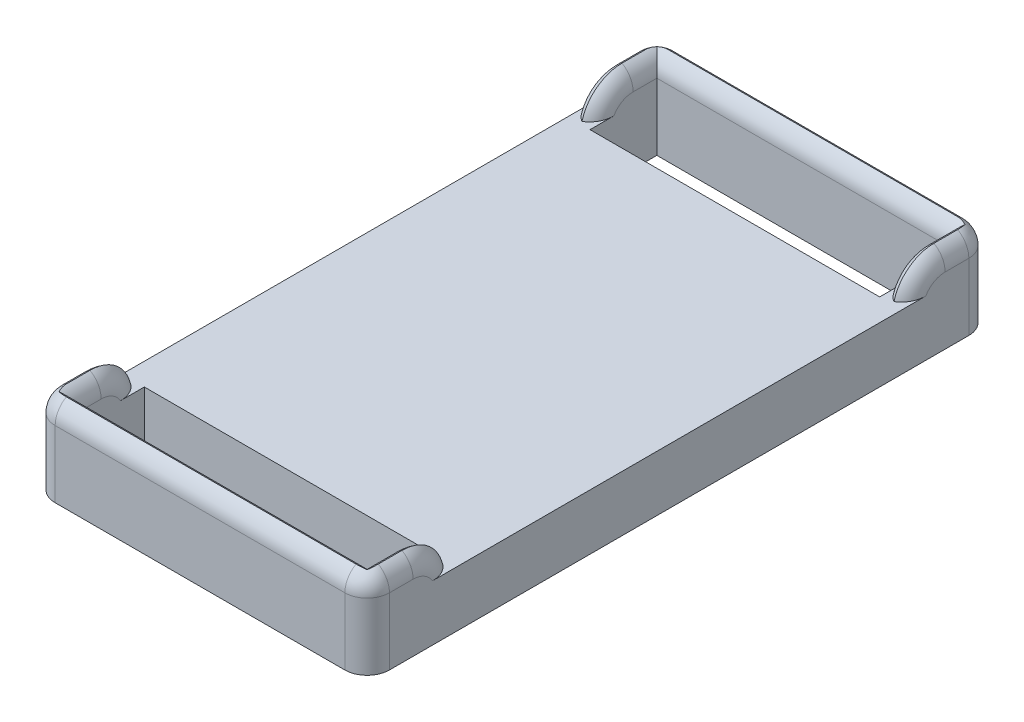
from build123d import *

# Parameters (mm, degrees)
SKETCH1_W           = 13
SKETCH1_H           = 3
BOSS_EXTRUDE1_DEPTH = 4
SKETCH2_W           = 15
SKETCH2_H           = 20
CUT_EXTRUDE1_DEPTH  = 1.5
FILLET1_R           = 2
FILLET2_R           = 1


with BuildPart() as part:
    # Sketch1 → Boss-Extrude1 (new body)
    with BuildSketch(Plane(origin=(0, 0, 0), x_dir=(1, 0, 0), z_dir=(0, 1, 0))):
        Polygon((0, 0), (0, 20), (0, 24), (15, 24), (15, 20), (15, 0), (15, -4), (0, -4), align=None)
        with Locations((7.5, 21.5)):
            Rectangle(SKETCH1_W, SKETCH1_H, mode=Mode.SUBTRACT)
        with Locations((7.5, -1.5)):
            Rectangle(SKETCH1_W, SKETCH1_H, mode=Mode.SUBTRACT)
    extrude(amount=BOSS_EXTRUDE1_DEPTH)

    # Sketch2 → Cut-Extrude1 (cut)
    with BuildSketch(Plane(origin=(0, 4, 0), x_dir=(1, 0, 0), z_dir=(0, 1, 0))):
        with Locations((7.5, 10)):
            Rectangle(SKETCH2_W, SKETCH2_H)
    extrude(amount=-CUT_EXTRUDE1_DEPTH, mode=Mode.SUBTRACT)

    # Fillet1
    # the kernel refuses this fillet: 2 mm, written as the material it takes off along each edge
    with BuildSketch(Plane(origin=(-4.841229183, 4, 0), x_dir=(0, -1, 0), z_dir=(1, 0, 0))) as fillet1_piece_1:
        with BuildLine():
            CenterArc((2, -1.936491673), FILLET1_R, 104.477512186, 75.522487814)
            Line((0, -1.936491673), (-0.04, -1.936491673))
            Line((-0.04, -1.936491673), (-0.04, 0))
            Line((-0.04, 0), (0, 0.04))
            ThreePointArc((0, 0.04), (0.75, 0.04), (1.49, 0.038729833))
            Line((1.49, 0.038729833), (1.5, 0))
        make_face()
    extrude(amount=10.682458366, mode=Mode.SUBTRACT)
    with BuildSketch(Plane(origin=(9.158770817, 4, 0), x_dir=(0, 0, 1), z_dir=(1, 0, 0)), Plane(origin=(19.841229183, 4, -20), x_dir=(0, 0, -1), z_dir=(-1, 0, 0)), Plane(origin=(5.841229183, 4, -20), x_dir=(0, 0, -1), z_dir=(-1, 0, 0))) as fillet1_piece_2:
        with BuildLine():
            CenterArc((1.936491673, 2), FILLET1_R, 194.477512186, 75.522487814)
            Line((0, 1.5), (-0.038729833, 1.49))
            ThreePointArc((-0.038729833, 1.49), (-0.04, 0.75), (-0.04, 0))
            Line((-0.04, 0), (0, -0.04))
            Line((0, -0.04), (1.936491673, -0.04))
            Line((1.936491673, -0.04), (1.936491673, 0))
        make_face()
    extrude(amount=10.682458366, mode=Mode.SUBTRACT)

    # Fillet2
    # the kernel refuses this fillet: 1 mm, written as the material it takes off along each edge
    with BuildSketch(Plane(origin=(14, 3, 3), x_dir=(0, 0, 1), z_dir=(1, 0, 0))) as fillet2_piece_1_section:
        Polygon((0, 0), (FILLET2_R * 1.02, 0), (FILLET2_R * 1.02, -FILLET2_R * 1.02), (0, -FILLET2_R * 1.02), align=None)
    fillet2_piece_1 = extrude(amount=FILLET2_R * 1.02, mode=Mode.PRIVATE)
    fillet2_piece_1 = fillet2_piece_1 - Plane(origin=(14, 3, 3), x_dir=(0, -0.7071067811865475, -0.7071067811865475), z_dir=(1, 0, 0)) * Sphere(FILLET2_R, mode=Mode.PRIVATE)
    add(fillet2_piece_1, mode=Mode.SUBTRACT)
    with BuildSketch(Plane(origin=(1, 3, 3), x_dir=(0, 0, 1), z_dir=(-1, 0, 0))) as fillet2_piece_2_section:
        Polygon((0, 0), (FILLET2_R * 1.02, 0), (FILLET2_R * 1.02, FILLET2_R * 1.02), (0, FILLET2_R * 1.02), align=None)
    fillet2_piece_2 = extrude(amount=FILLET2_R * 1.02, mode=Mode.PRIVATE)
    fillet2_piece_2 = fillet2_piece_2 - Plane(origin=(1, 3, 3), x_dir=(0, -0.7071067811865475, -0.7071067811865475), z_dir=(-1, 0, 0)) * Sphere(FILLET2_R, mode=Mode.PRIVATE)
    add(fillet2_piece_2, mode=Mode.SUBTRACT)
    with BuildSketch(Plane(origin=(1, 3, -23), x_dir=(0, 1, 0), z_dir=(-1, 0, 0))) as fillet2_piece_3_section:
        Polygon((0, 0), (FILLET2_R * 1.02, 0), (FILLET2_R * 1.02, FILLET2_R * 1.02), (0, FILLET2_R * 1.02), align=None)
    fillet2_piece_3 = extrude(amount=FILLET2_R * 1.02, mode=Mode.PRIVATE)
    fillet2_piece_3 = fillet2_piece_3 - Plane(origin=(1, 3, -23), x_dir=(0, -0.7071067811865475, 0.7071067811865475), z_dir=(-1, 0, 0)) * Sphere(FILLET2_R, mode=Mode.PRIVATE)
    add(fillet2_piece_3, mode=Mode.SUBTRACT)
    with BuildSketch(Plane(origin=(14, 3, -23), x_dir=(0, 0, -1), z_dir=(0, 1, 0))) as fillet2_piece_4_section:
        Polygon((0, 0), (FILLET2_R * 1.02, 0), (FILLET2_R * 1.02, -FILLET2_R * 1.02), (0, -FILLET2_R * 1.02), align=None)
    fillet2_piece_4 = extrude(amount=FILLET2_R * 1.02, mode=Mode.PRIVATE)
    fillet2_piece_4 = fillet2_piece_4 - Plane(origin=(14, 3, -23), x_dir=(-0.7071067811865475, 0, 0.7071067811865475), z_dir=(0, 1, 0)) * Sphere(FILLET2_R, mode=Mode.PRIVATE)
    add(fillet2_piece_4, mode=Mode.SUBTRACT)
    with BuildSketch(Plane(origin=(14, 2, 1.936491673), x_dir=(0, 1, 0), z_dir=(0, 0, 1))) as fillet2_piece_5_section:
        with BuildLine():
            CenterArc((2 - FILLET2_R, -FILLET2_R), FILLET2_R, 0, 90)
            Line((2, -FILLET2_R), (2 + FILLET2_R * 0.02, -FILLET2_R))
            Line((2 + FILLET2_R * 0.02, -FILLET2_R), (2 + FILLET2_R * 0.02, FILLET2_R * 0.02))
            Line((2 + FILLET2_R * 0.02, FILLET2_R * 0.02), (2 - FILLET2_R, FILLET2_R * 0.02))
            Line((2 - FILLET2_R, FILLET2_R * 0.02), (2 - FILLET2_R, 0))
        make_face()
    fillet2_piece_5 = revolve(axis=Axis((14, 2, 1.936491673), (-1, 0, 0)), revolution_arc=147.162469187, mode=Mode.PRIVATE)
    fillet2_piece_5 = split(fillet2_piece_5, bisect_by=Plane(origin=(14.245105453, 3.345971108, 0), z_dir=(0, 0, 1)), keep=Keep.TOP, mode=Mode.PRIVATE)
    fillet2_piece_5 = split(fillet2_piece_5, bisect_by=Plane(origin=(14.245105453, 2.5, 0.926068322), z_dir=(0, 1, 0)), keep=Keep.TOP, mode=Mode.PRIVATE)
    add(fillet2_piece_5, mode=Mode.SUBTRACT)
    with BuildSketch(Plane(origin=(15, 2, 1.936491673), x_dir=(0, 1, 0), z_dir=(0, 0, 1))) as fillet2_piece_6_section:
        with BuildLine():
            CenterArc((2 - FILLET2_R, FILLET2_R), FILLET2_R, 270, 90)
            Line((2 - FILLET2_R, 0), (2 - FILLET2_R, -FILLET2_R * 0.02))
            Line((2 - FILLET2_R, -FILLET2_R * 0.02), (2 + FILLET2_R * 0.02, -FILLET2_R * 0.02))
            Line((2 + FILLET2_R * 0.02, -FILLET2_R * 0.02), (2 + FILLET2_R * 0.02, FILLET2_R))
            Line((2 + FILLET2_R * 0.02, FILLET2_R), (2, FILLET2_R))
        make_face()
    fillet2_piece_6 = revolve(axis=Axis((15, 2, 1.936491673), (-1, 0, 0)), revolution_arc=147.162469187, mode=Mode.PRIVATE)
    fillet2_piece_6 = split(fillet2_piece_6, bisect_by=Plane(origin=(14.754554239, 2.5, 0.924771773), z_dir=(0, 1, 0)), keep=Keep.TOP, mode=Mode.PRIVATE)
    add(fillet2_piece_6, mode=Mode.SUBTRACT)
    with BuildSketch(Plane(origin=(0, 2, 1.936491673), x_dir=(0, 1, 0), z_dir=(0, 0, 1))) as fillet2_piece_7_section:
        with BuildLine():
            CenterArc((2 - FILLET2_R, -FILLET2_R), FILLET2_R, 0, 90)
            Line((2, -FILLET2_R), (2 + FILLET2_R * 0.02, -FILLET2_R))
            Line((2 + FILLET2_R * 0.02, -FILLET2_R), (2 + FILLET2_R * 0.02, FILLET2_R * 0.02))
            Line((2 + FILLET2_R * 0.02, FILLET2_R * 0.02), (2 - FILLET2_R, FILLET2_R * 0.02))
            Line((2 - FILLET2_R, FILLET2_R * 0.02), (2 - FILLET2_R, 0))
        make_face()
    fillet2_piece_7 = revolve(axis=Axis((0, 2, 1.936491673), (-1, 0, 0)), revolution_arc=147.162469187, mode=Mode.PRIVATE)
    fillet2_piece_7 = split(fillet2_piece_7, bisect_by=Plane(origin=(0.245445759, 2.5, 0.924771781), z_dir=(0, 1, 0)), keep=Keep.TOP, mode=Mode.PRIVATE)
    add(fillet2_piece_7, mode=Mode.SUBTRACT)
    with BuildSketch(Plane(origin=(1, 2, 1.936491673), x_dir=(0, 1, 0), z_dir=(0, 0, 1))) as fillet2_piece_8_section:
        with BuildLine():
            CenterArc((2 - FILLET2_R, FILLET2_R), FILLET2_R, 270, 90)
            Line((2, FILLET2_R), (2 + FILLET2_R * 0.02, FILLET2_R))
            Line((2 + FILLET2_R * 0.02, FILLET2_R), (2 + FILLET2_R * 0.02, -FILLET2_R * 0.02))
            Line((2 + FILLET2_R * 0.02, -FILLET2_R * 0.02), (2 - FILLET2_R, -FILLET2_R * 0.02))
            Line((2 - FILLET2_R, -FILLET2_R * 0.02), (2 - FILLET2_R, 0))
        make_face()
    fillet2_piece_8 = revolve(axis=Axis((1, 2, 1.936491673), (-1, 0, 0)), revolution_arc=147.162469187, mode=Mode.PRIVATE)
    fillet2_piece_8 = split(fillet2_piece_8, bisect_by=Plane(origin=(0.754894544, 3.345971097, 0), z_dir=(0, 0, 1)), keep=Keep.TOP, mode=Mode.PRIVATE)
    fillet2_piece_8 = split(fillet2_piece_8, bisect_by=Plane(origin=(0.754894544, 2.5, 0.926068314), z_dir=(0, 1, 0)), keep=Keep.TOP, mode=Mode.PRIVATE)
    add(fillet2_piece_8, mode=Mode.SUBTRACT)
    with BuildSketch(Plane(origin=(1, 2, -21.936491673), x_dir=(0, 1, 0), z_dir=(0, 0, -1))) as fillet2_piece_9_section:
        with BuildLine():
            CenterArc((2 - FILLET2_R, -FILLET2_R), FILLET2_R, 0, 90)
            Line((2, -FILLET2_R), (2 + FILLET2_R * 0.02, -FILLET2_R))
            Line((2 + FILLET2_R * 0.02, -FILLET2_R), (2 + FILLET2_R * 0.02, FILLET2_R * 0.02))
            Line((2 + FILLET2_R * 0.02, FILLET2_R * 0.02), (2 - FILLET2_R, FILLET2_R * 0.02))
            Line((2 - FILLET2_R, FILLET2_R * 0.02), (2 - FILLET2_R, 0))
        make_face()
    fillet2_piece_9 = revolve(axis=Axis((1, 2, -21.936491673), (1, 0, 0)), revolution_arc=147.162469187, mode=Mode.PRIVATE)
    fillet2_piece_9 = split(fillet2_piece_9, bisect_by=Plane(origin=(0.754894544, 3.345971097, -20), z_dir=(0, 0, -1)), keep=Keep.TOP, mode=Mode.PRIVATE)
    fillet2_piece_9 = split(fillet2_piece_9, bisect_by=Plane(origin=(0.754894544, 2.5, -20.926068314), z_dir=(0, 1, 0)), keep=Keep.TOP, mode=Mode.PRIVATE)
    add(fillet2_piece_9, mode=Mode.SUBTRACT)
    with BuildSketch(Plane(origin=(0, 2, -21.936491673), x_dir=(0, 1, 0), z_dir=(0, 0, -1))) as fillet2_piece_10_section:
        with BuildLine():
            CenterArc((2 - FILLET2_R, FILLET2_R), FILLET2_R, 270, 90)
            Line((2, FILLET2_R), (2 + FILLET2_R * 0.02, FILLET2_R))
            Line((2 + FILLET2_R * 0.02, FILLET2_R), (2 + FILLET2_R * 0.02, -FILLET2_R * 0.02))
            Line((2 + FILLET2_R * 0.02, -FILLET2_R * 0.02), (2 - FILLET2_R, -FILLET2_R * 0.02))
            Line((2 - FILLET2_R, -FILLET2_R * 0.02), (2 - FILLET2_R, 0))
        make_face()
    fillet2_piece_10 = revolve(axis=Axis((0, 2, -21.936491673), (1, 0, 0)), revolution_arc=147.162469187, mode=Mode.PRIVATE)
    fillet2_piece_10 = split(fillet2_piece_10, bisect_by=Plane(origin=(0.245445759, 2.5, -20.924771781), z_dir=(0, 1, 0)), keep=Keep.TOP, mode=Mode.PRIVATE)
    add(fillet2_piece_10, mode=Mode.SUBTRACT)
    with BuildSketch(Plane(origin=(15, 2, -21.936491673), x_dir=(0, 1, 0), z_dir=(0, 0, -1))) as fillet2_piece_11_section:
        with BuildLine():
            CenterArc((2 - FILLET2_R, -FILLET2_R), FILLET2_R, 0, 90)
            Line((2 - FILLET2_R, 0), (2 - FILLET2_R, FILLET2_R * 0.02))
            Line((2 - FILLET2_R, FILLET2_R * 0.02), (2 + FILLET2_R * 0.02, FILLET2_R * 0.02))
            Line((2 + FILLET2_R * 0.02, FILLET2_R * 0.02), (2 + FILLET2_R * 0.02, -FILLET2_R))
            Line((2 + FILLET2_R * 0.02, -FILLET2_R), (2, -FILLET2_R))
        make_face()
    fillet2_piece_11 = revolve(axis=Axis((15, 2, -21.936491673), (1, 0, 0)), revolution_arc=147.162469187, mode=Mode.PRIVATE)
    fillet2_piece_11 = split(fillet2_piece_11, bisect_by=Plane(origin=(14.754554239, 2.5, -20.924771773), z_dir=(0, 1, 0)), keep=Keep.TOP, mode=Mode.PRIVATE)
    add(fillet2_piece_11, mode=Mode.SUBTRACT)
    with BuildSketch(Plane(origin=(14, 2, -21.936491673), x_dir=(0, 1, 0), z_dir=(0, 0, -1))) as fillet2_piece_12_section:
        with BuildLine():
            CenterArc((2 - FILLET2_R, FILLET2_R), FILLET2_R, 270, 90)
            Line((2, FILLET2_R), (2 + FILLET2_R * 0.02, FILLET2_R))
            Line((2 + FILLET2_R * 0.02, FILLET2_R), (2 + FILLET2_R * 0.02, -FILLET2_R * 0.02))
            Line((2 + FILLET2_R * 0.02, -FILLET2_R * 0.02), (2 - FILLET2_R, -FILLET2_R * 0.02))
            Line((2 - FILLET2_R, -FILLET2_R * 0.02), (2 - FILLET2_R, 0))
        make_face()
    fillet2_piece_12 = revolve(axis=Axis((14, 2, -21.936491673), (1, 0, 0)), revolution_arc=147.162469187, mode=Mode.PRIVATE)
    fillet2_piece_12 = split(fillet2_piece_12, bisect_by=Plane(origin=(14.245105453, 3.345971108, -20), z_dir=(0, 0, -1)), keep=Keep.TOP, mode=Mode.PRIVATE)
    fillet2_piece_12 = split(fillet2_piece_12, bisect_by=Plane(origin=(14.245105453, 2.5, -20.926068322), z_dir=(0, 1, 0)), keep=Keep.TOP, mode=Mode.PRIVATE)
    add(fillet2_piece_12, mode=Mode.SUBTRACT)
    with BuildSketch(Plane(origin=(14, 4, 3), x_dir=(0, -1, 0), z_dir=(-1, 0, 0)), Plane(origin=(1, 4, -23), x_dir=(0, -1, 0), z_dir=(1, 0, 0)), Plane(origin=(1, 4, -24), x_dir=(0, 0, 1), z_dir=(1, 0, 0))) as fillet2_piece_13:
        with BuildLine():
            CenterArc((FILLET2_R, FILLET2_R), FILLET2_R, 180, 90)
            Line((0, FILLET2_R), (-FILLET2_R * 0.02, FILLET2_R))
            Line((-FILLET2_R * 0.02, FILLET2_R), (-FILLET2_R * 0.02, -FILLET2_R * 0.02))
            Line((-FILLET2_R * 0.02, -FILLET2_R * 0.02), (FILLET2_R, -FILLET2_R * 0.02))
            Line((FILLET2_R, -FILLET2_R * 0.02), (FILLET2_R, 0))
        make_face()
    extrude(amount=13, mode=Mode.SUBTRACT)
    with BuildSketch(Plane(origin=(14, 4, 1.936491673), x_dir=(0, -1, 0), z_dir=(0, 0, 1)), Plane(origin=(1, 4, 3), x_dir=(0, -1, 0), z_dir=(0, 0, -1)), Plane(origin=(1, 4, -21.936491673), x_dir=(0, -1, 0), z_dir=(0, 0, -1)), Plane(origin=(14, 4, -23), x_dir=(0, -1, 0), z_dir=(0, 0, 1))) as fillet2_piece_14:
        with BuildLine():
            CenterArc((FILLET2_R, FILLET2_R), FILLET2_R, 180, 90)
            Line((0, FILLET2_R), (-FILLET2_R * 0.02, FILLET2_R))
            Line((-FILLET2_R * 0.02, FILLET2_R), (-FILLET2_R * 0.02, -FILLET2_R * 0.02))
            Line((-FILLET2_R * 0.02, -FILLET2_R * 0.02), (FILLET2_R, -FILLET2_R * 0.02))
            Line((FILLET2_R, -FILLET2_R * 0.02), (FILLET2_R, 0))
        make_face()
    extrude(amount=1.063508327, mode=Mode.SUBTRACT)
    with BuildSketch(Plane(origin=(15, 4, 1.936491673), x_dir=(0, -1, 0), z_dir=(0, 0, 1)), Plane(origin=(0, 4, 3), x_dir=(0, -1, 0), z_dir=(0, 0, -1)), Plane(origin=(0, 4, -21.936491673), x_dir=(0, -1, 0), z_dir=(0, 0, -1)), Plane(origin=(15, 4, -23), x_dir=(0, -1, 0), z_dir=(0, 0, 1))) as fillet2_piece_15:
        with BuildLine():
            CenterArc((FILLET2_R, -FILLET2_R), FILLET2_R, 90, 90)
            Line((0, -FILLET2_R), (-FILLET2_R * 0.02, -FILLET2_R))
            Line((-FILLET2_R * 0.02, -FILLET2_R), (-FILLET2_R * 0.02, FILLET2_R * 0.02))
            Line((-FILLET2_R * 0.02, FILLET2_R * 0.02), (FILLET2_R, FILLET2_R * 0.02))
            Line((FILLET2_R, FILLET2_R * 0.02), (FILLET2_R, 0))
        make_face()
    extrude(amount=1.063508327, mode=Mode.SUBTRACT)
    with BuildSketch(Plane(origin=(14, 4, 4), x_dir=(0, -1, 0), z_dir=(-1, 0, 0))) as fillet2_piece_16:
        with BuildLine():
            CenterArc((FILLET2_R, -FILLET2_R), FILLET2_R, 90, 90)
            Line((0, -FILLET2_R), (-FILLET2_R * 0.02, -FILLET2_R))
            Line((-FILLET2_R * 0.02, -FILLET2_R), (-FILLET2_R * 0.02, FILLET2_R * 0.02))
            Line((-FILLET2_R * 0.02, FILLET2_R * 0.02), (FILLET2_R, FILLET2_R * 0.02))
            Line((FILLET2_R, FILLET2_R * 0.02), (FILLET2_R, 0))
        make_face()
    extrude(amount=13, mode=Mode.SUBTRACT)
    with BuildSketch(Plane(origin=(0, 0, -24), x_dir=(0, 0, 1), z_dir=(0, 1, 0)), Plane(origin=(15, 0, 4), x_dir=(0, 0, -1), z_dir=(0, 1, 0))) as fillet2_piece_17:
        with BuildLine():
            CenterArc((FILLET2_R, FILLET2_R), FILLET2_R, 180, 90)
            Line((0, FILLET2_R), (-FILLET2_R * 0.02, FILLET2_R))
            Line((-FILLET2_R * 0.02, FILLET2_R), (-FILLET2_R * 0.02, -FILLET2_R * 0.02))
            Line((-FILLET2_R * 0.02, -FILLET2_R * 0.02), (FILLET2_R, -FILLET2_R * 0.02))
            Line((FILLET2_R, -FILLET2_R * 0.02), (FILLET2_R, 0))
        make_face()
    extrude(amount=3, mode=Mode.SUBTRACT)
    with BuildSketch(Plane(origin=(15, 0, -24), x_dir=(0, 0, 1), z_dir=(0, 1, 0)), Plane(origin=(0, 0, 4), x_dir=(0, 0, -1), z_dir=(0, 1, 0))) as fillet2_piece_18:
        with BuildLine():
            CenterArc((FILLET2_R, -FILLET2_R), FILLET2_R, 90, 90)
            Line((0, -FILLET2_R), (-FILLET2_R * 0.02, -FILLET2_R))
            Line((-FILLET2_R * 0.02, -FILLET2_R), (-FILLET2_R * 0.02, FILLET2_R * 0.02))
            Line((-FILLET2_R * 0.02, FILLET2_R * 0.02), (FILLET2_R, FILLET2_R * 0.02))
            Line((FILLET2_R, FILLET2_R * 0.02), (FILLET2_R, 0))
        make_face()
    extrude(amount=3, mode=Mode.SUBTRACT)
    with BuildSketch(Plane(origin=(14, 4, 1.936491673), x_dir=(0, -1, 0), z_dir=(0, 0, 1))) as fillet2_piece_19a_section:
        with BuildLine():
            CenterArc((FILLET2_R, FILLET2_R), FILLET2_R, 180, 90)
            Line((0, FILLET2_R), (-FILLET2_R * 0.02, FILLET2_R))
            Line((-FILLET2_R * 0.02, FILLET2_R), (-FILLET2_R * 0.02, -FILLET2_R * 0.02))
            Line((-FILLET2_R * 0.02, -FILLET2_R * 0.02), (FILLET2_R, -FILLET2_R * 0.02))
            Line((FILLET2_R, -FILLET2_R * 0.02), (FILLET2_R, 0))
        make_face()
    fillet2_piece_19a = extrude(amount=3.563508327, mode=Mode.PRIVATE)
    fillet2_piece_19a = split(fillet2_piece_19a, bisect_by=Plane(origin=(14.226395114, 3.773604886, 3), z_dir=(0, 0, 1)), keep=Keep.TOP, mode=Mode.PRIVATE)
    with BuildSketch(Plane(origin=(16.5, 4, 3), x_dir=(0, -1, 0), z_dir=(-1, 0, 0))) as fillet2_piece_19b_section:
        with BuildLine():
            CenterArc((FILLET2_R, FILLET2_R), FILLET2_R, 180, 90)
            Line((0, FILLET2_R), (-FILLET2_R * 0.02, FILLET2_R))
            Line((-FILLET2_R * 0.02, FILLET2_R), (-FILLET2_R * 0.02, -FILLET2_R * 0.02))
            Line((-FILLET2_R * 0.02, -FILLET2_R * 0.02), (FILLET2_R, -FILLET2_R * 0.02))
            Line((FILLET2_R, -FILLET2_R * 0.02), (FILLET2_R, 0))
        make_face()
    fillet2_piece_19b = extrude(amount=15.5, mode=Mode.PRIVATE)
    fillet2_piece_19b = split(fillet2_piece_19b, bisect_by=Plane(origin=(14, 3.773604886, 3.226395114), z_dir=(1, 0, 0)), keep=Keep.TOP, mode=Mode.PRIVATE)
    fillet2_piece_19 = fillet2_piece_19a & fillet2_piece_19b
    add(fillet2_piece_19, mode=Mode.SUBTRACT)
    with BuildSketch(Plane(origin=(14, 4, 3), x_dir=(0, -1, 0), z_dir=(-1, 0, 0))) as fillet2_piece_20a_section:
        with BuildLine():
            CenterArc((FILLET2_R, FILLET2_R), FILLET2_R, 180, 90)
            Line((0, FILLET2_R), (-FILLET2_R * 0.02, FILLET2_R))
            Line((-FILLET2_R * 0.02, FILLET2_R), (-FILLET2_R * 0.02, -FILLET2_R * 0.02))
            Line((-FILLET2_R * 0.02, -FILLET2_R * 0.02), (FILLET2_R, -FILLET2_R * 0.02))
            Line((FILLET2_R, -FILLET2_R * 0.02), (FILLET2_R, 0))
        make_face()
    fillet2_piece_20a = extrude(amount=15.5, mode=Mode.PRIVATE)
    fillet2_piece_20a = split(fillet2_piece_20a, bisect_by=Plane(origin=(1, 3.773604886, 3.226395114), z_dir=(-1, 0, 0)), keep=Keep.TOP, mode=Mode.PRIVATE)
    with BuildSketch(Plane(origin=(1, 4, 5.5), x_dir=(0, -1, 0), z_dir=(0, 0, -1))) as fillet2_piece_20b_section:
        with BuildLine():
            CenterArc((FILLET2_R, FILLET2_R), FILLET2_R, 180, 90)
            Line((0, FILLET2_R), (-FILLET2_R * 0.02, FILLET2_R))
            Line((-FILLET2_R * 0.02, FILLET2_R), (-FILLET2_R * 0.02, -FILLET2_R * 0.02))
            Line((-FILLET2_R * 0.02, -FILLET2_R * 0.02), (FILLET2_R, -FILLET2_R * 0.02))
            Line((FILLET2_R, -FILLET2_R * 0.02), (FILLET2_R, 0))
        make_face()
    fillet2_piece_20b = extrude(amount=3.563508327, mode=Mode.PRIVATE)
    fillet2_piece_20b = split(fillet2_piece_20b, bisect_by=Plane(origin=(0.773604886, 3.773604886, 3), z_dir=(0, 0, 1)), keep=Keep.TOP, mode=Mode.PRIVATE)
    fillet2_piece_20 = fillet2_piece_20a & fillet2_piece_20b
    add(fillet2_piece_20, mode=Mode.SUBTRACT)
    with BuildSketch(Plane(origin=(1, 4, -21.936491673), x_dir=(0, -1, 0), z_dir=(0, 0, -1))) as fillet2_piece_21a_section:
        with BuildLine():
            CenterArc((FILLET2_R, FILLET2_R), FILLET2_R, 180, 90)
            Line((0, FILLET2_R), (-FILLET2_R * 0.02, FILLET2_R))
            Line((-FILLET2_R * 0.02, FILLET2_R), (-FILLET2_R * 0.02, -FILLET2_R * 0.02))
            Line((-FILLET2_R * 0.02, -FILLET2_R * 0.02), (FILLET2_R, -FILLET2_R * 0.02))
            Line((FILLET2_R, -FILLET2_R * 0.02), (FILLET2_R, 0))
        make_face()
    fillet2_piece_21a = extrude(amount=3.563508327, mode=Mode.PRIVATE)
    fillet2_piece_21a = split(fillet2_piece_21a, bisect_by=Plane(origin=(0.773604886, 3.773604886, -23), z_dir=(0, 0, -1)), keep=Keep.TOP, mode=Mode.PRIVATE)
    with BuildSketch(Plane(origin=(-1.5, 4, -23), x_dir=(0, -1, 0), z_dir=(1, 0, 0))) as fillet2_piece_21b_section:
        with BuildLine():
            CenterArc((FILLET2_R, FILLET2_R), FILLET2_R, 180, 90)
            Line((0, FILLET2_R), (-FILLET2_R * 0.02, FILLET2_R))
            Line((-FILLET2_R * 0.02, FILLET2_R), (-FILLET2_R * 0.02, -FILLET2_R * 0.02))
            Line((-FILLET2_R * 0.02, -FILLET2_R * 0.02), (FILLET2_R, -FILLET2_R * 0.02))
            Line((FILLET2_R, -FILLET2_R * 0.02), (FILLET2_R, 0))
        make_face()
    fillet2_piece_21b = extrude(amount=15.5, mode=Mode.PRIVATE)
    fillet2_piece_21b = split(fillet2_piece_21b, bisect_by=Plane(origin=(1, 3.773604886, -23.226395114), z_dir=(-1, 0, 0)), keep=Keep.TOP, mode=Mode.PRIVATE)
    fillet2_piece_21 = fillet2_piece_21a & fillet2_piece_21b
    add(fillet2_piece_21, mode=Mode.SUBTRACT)
    with BuildSketch(Plane(origin=(1, 4, -23), x_dir=(0, -1, 0), z_dir=(1, 0, 0))) as fillet2_piece_22a_section:
        with BuildLine():
            CenterArc((FILLET2_R, FILLET2_R), FILLET2_R, 180, 90)
            Line((0, FILLET2_R), (-FILLET2_R * 0.02, FILLET2_R))
            Line((-FILLET2_R * 0.02, FILLET2_R), (-FILLET2_R * 0.02, -FILLET2_R * 0.02))
            Line((-FILLET2_R * 0.02, -FILLET2_R * 0.02), (FILLET2_R, -FILLET2_R * 0.02))
            Line((FILLET2_R, -FILLET2_R * 0.02), (FILLET2_R, 0))
        make_face()
    fillet2_piece_22a = extrude(amount=15.5, mode=Mode.PRIVATE)
    fillet2_piece_22a = split(fillet2_piece_22a, bisect_by=Plane(origin=(14, 3.773604886, -23.226395114), z_dir=(1, 0, 0)), keep=Keep.TOP, mode=Mode.PRIVATE)
    with BuildSketch(Plane(origin=(14, 4, -25.5), x_dir=(0, -1, 0), z_dir=(0, 0, 1))) as fillet2_piece_22b_section:
        with BuildLine():
            CenterArc((FILLET2_R, FILLET2_R), FILLET2_R, 180, 90)
            Line((0, FILLET2_R), (-FILLET2_R * 0.02, FILLET2_R))
            Line((-FILLET2_R * 0.02, FILLET2_R), (-FILLET2_R * 0.02, -FILLET2_R * 0.02))
            Line((-FILLET2_R * 0.02, -FILLET2_R * 0.02), (FILLET2_R, -FILLET2_R * 0.02))
            Line((FILLET2_R, -FILLET2_R * 0.02), (FILLET2_R, 0))
        make_face()
    fillet2_piece_22b = extrude(amount=3.563508327, mode=Mode.PRIVATE)
    fillet2_piece_22b = split(fillet2_piece_22b, bisect_by=Plane(origin=(14.226395114, 3.773604886, -23), z_dir=(0, 0, -1)), keep=Keep.TOP, mode=Mode.PRIVATE)
    fillet2_piece_22 = fillet2_piece_22a & fillet2_piece_22b
    add(fillet2_piece_22, mode=Mode.SUBTRACT)


solid = part.part
